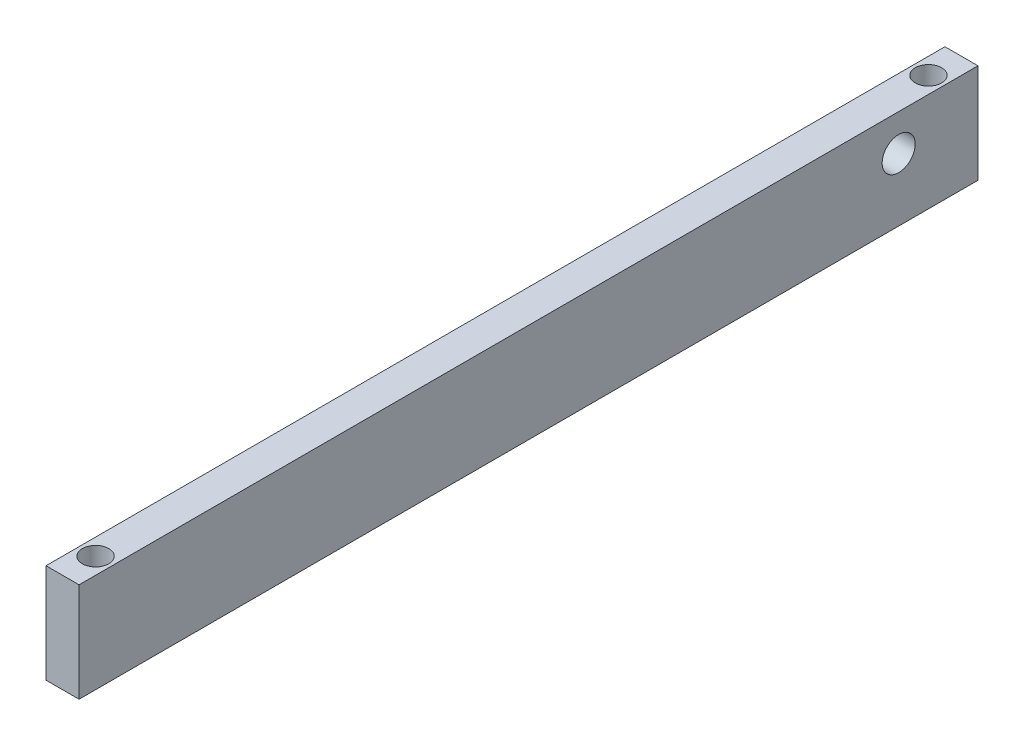
from build123d import *

# Parameters (mm, degrees)
BOSS_EXTRUDE1_DEPTH = 172.72
CUT_EXTRUDE1_REACH  = 176.231
SKETCH2_R           = 3.175
SKETCH5_W           = 6.35
SKETCH5_H           = 6.35
CUT_EXTRUDE4_DEPTH  = 345.44
SKETCH3_R           = 2.54
CUT_EXTRUDE5_DEPTH  = 175.230855189
SKETCH4_R           = 2.54
CUT_EXTRUDE6_DEPTH  = 175.230855189


with BuildPart() as part:
    # Sketch1 → Boss-Extrude1 (new body)
    with BuildSketch(Plane.XY):
        Polygon((0, 0), (-12.7, 0), (-12.7, 19.05), (-6.35, 19.05), (-6.35, 6.35), (0, 6.35), align=None)
    extrude(amount=-BOSS_EXTRUDE1_DEPTH)

    # Sketch2 → Cut-Extrude1 (cut, up to next)
    with BuildSketch(Plane.ZY.offset(12.7), mode=Mode.PRIVATE) as cut_extrude1_sk1:
        with Locations((-157.48, 12.065)):
            Circle(SKETCH2_R)
    cut_extrude1_tool1 = extrude(cut_extrude1_sk1.sketch, amount=-CUT_EXTRUDE1_REACH, mode=Mode.PRIVATE) & part.part
    add(cut_extrude1_tool1.solids().sort_by_distance((-12.7, 12.065, -157.48))[0], mode=Mode.SUBTRACT)

    # Sketch5 → Cut-Extrude4 (cut)
    with BuildSketch(Plane(origin=(0, 0, -172.72), x_dir=(-1, 0, 0), z_dir=(0, 0, -1))):
        with Locations((3.175, 3.175)):
            Rectangle(SKETCH5_W, SKETCH5_H)
    extrude(amount=-CUT_EXTRUDE4_DEPTH, mode=Mode.SUBTRACT)

    # Sketch3 → Cut-Extrude5 (cut, through all)
    with BuildSketch(Plane(origin=(0, 19.05, 0), x_dir=(1, 0, 0), z_dir=(0, 1, 0))):
        with Locations((-9.525, 6.35)):
            Circle(SKETCH3_R)
    extrude(amount=-CUT_EXTRUDE5_DEPTH, mode=Mode.SUBTRACT)

    # Sketch4 → Cut-Extrude6 (cut, through all)
    with BuildSketch(Plane.XZ):
        with Locations((-9.525, -166.37)):
            Circle(SKETCH4_R)
        with Locations((-9.525, -6.35)):
            Circle(SKETCH4_R)
    extrude(amount=-CUT_EXTRUDE6_DEPTH, mode=Mode.SUBTRACT)


solid = part.part
